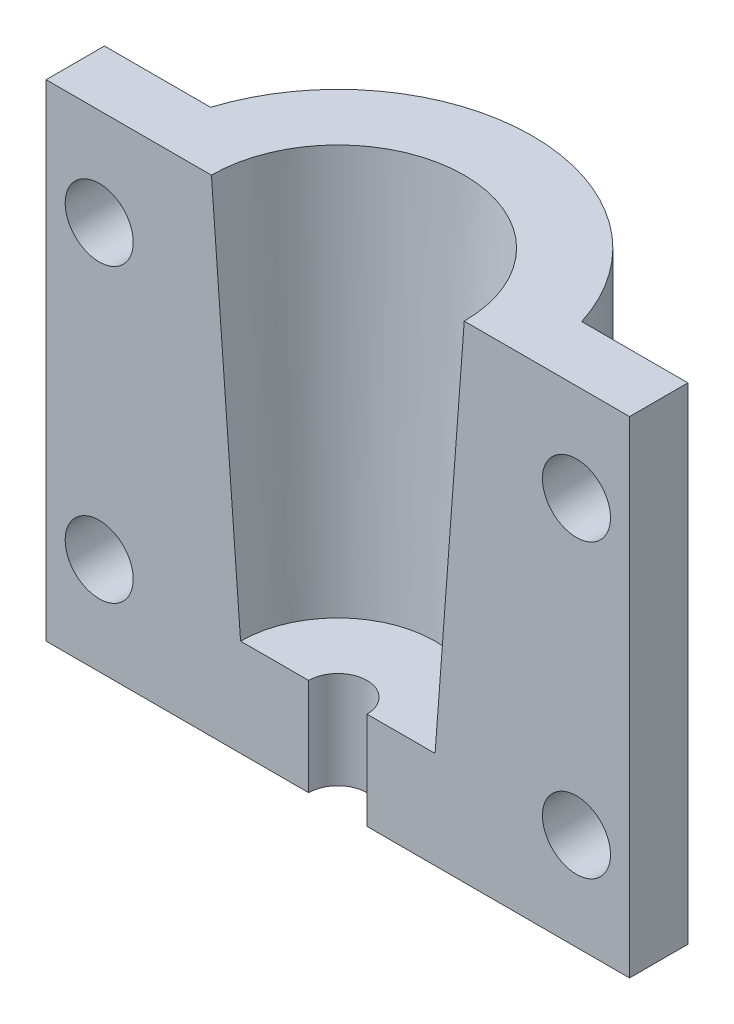
from build123d import *

# Parameters (mm, degrees)
SKETCH1_R           = 10
BOSS_EXTRUDE1_DEPTH = 25
SKETCH4_R           = 1.5
BOSS_EXTRUDE2_DEPTH = 20
CUT_EXTRUDE2_DEPTH  = 29.722813233
SKETCH6_W           = 6.24870068
SKETCH6_H           = 3
BOSS_EXTRUDE3_DEPTH = 25
SKETCH7_R           = 1.75
CUT_EXTRUDE3_DEPTH  = 30.983328701


# Read off the part's stored shape, not the designer's step: Boundary-Cut1
with BuildPart() as part:
    # Sketch1 → Boss-Extrude1 (new body)
    with BuildSketch(Plane(origin=(0, 0, 0), x_dir=(1, 0, 0), z_dir=(0, 1, 0))):
        with Locations(Location((0, 0, 0), (0, 0, 270))):
            Circle(SKETCH1_R)
    extrude(amount=BOSS_EXTRUDE1_DEPTH)

    # Boundary-Cut1 outline → Boundary-Cut1 (revolve, cut)
    with BuildSketch(Plane.XY):
        Polygon((0, 5), (5, 5), (6.5, 25), (0, 25), align=None)
    revolve(axis=Axis((0, 0, 0), (0, 1, 0)), mode=Mode.SUBTRACT)

    # Sketch4 → Boss-Extrude2 (add)
    with BuildSketch(Plane(origin=(0, 5, 0), x_dir=(1, 0, 0), z_dir=(0, 1, 0))):
        with Locations(Location((0, 0, 0), (0, 0, 90))):
            Circle(SKETCH4_R)
    extrude(amount=BOSS_EXTRUDE2_DEPTH)

    # Sketch5 → Cut-Extrude2 (cut, through all)
    with BuildSketch(Plane(origin=(0, 25, 0), x_dir=(1, 0, 0), z_dir=(0, 1, 0))):
        with BuildLine():
            Line((-10, 0), (-1.5, 0))
            ThreePointArc((-1.5, 0), (0, 1.5), (1.5, 0))
            Line((1.5, 0), (10, 0))
            ThreePointArc((10, 0), (0, -10), (-10, 0))
        make_face()
    extrude(amount=-CUT_EXTRUDE2_DEPTH, mode=Mode.SUBTRACT)

    # Sketch6 → Boss-Extrude3 (add)
    with BuildSketch(Plane(origin=(0, 0, 0), x_dir=(1, 0, 0), z_dir=(0, 1, 0))):
        with Locations((-11.87564966, 1.5)):
            Rectangle(SKETCH6_W, SKETCH6_H)
    boss_extrude3 = extrude(amount=BOSS_EXTRUDE3_DEPTH)

    # Sketch7 → Cut-Extrude3 (cut, through all)
    with BuildSketch(Plane(origin=(0, 0, -3), x_dir=(-1, 0, 0), z_dir=(0, 0, -1))):
        with Locations((12.269696007, 5)):
            Circle(SKETCH7_R)
        with Locations((12.269696007, 20)):
            Circle(SKETCH7_R)
    cut_extrude3 = extrude(amount=-CUT_EXTRUDE3_DEPTH, mode=Mode.SUBTRACT)

    # Mirror1: Boss-Extrude3, Cut-Extrude3 across plane
    add(boss_extrude3.mirror(Plane(origin=(0, 0, 0), x_dir=(0, 0, 1), z_dir=(1, 0, 0))))
    add(cut_extrude3.mirror(Plane(origin=(0, 0, 0), x_dir=(0, 0, 1), z_dir=(1, 0, 0))), mode=Mode.SUBTRACT)


solid = part.part
